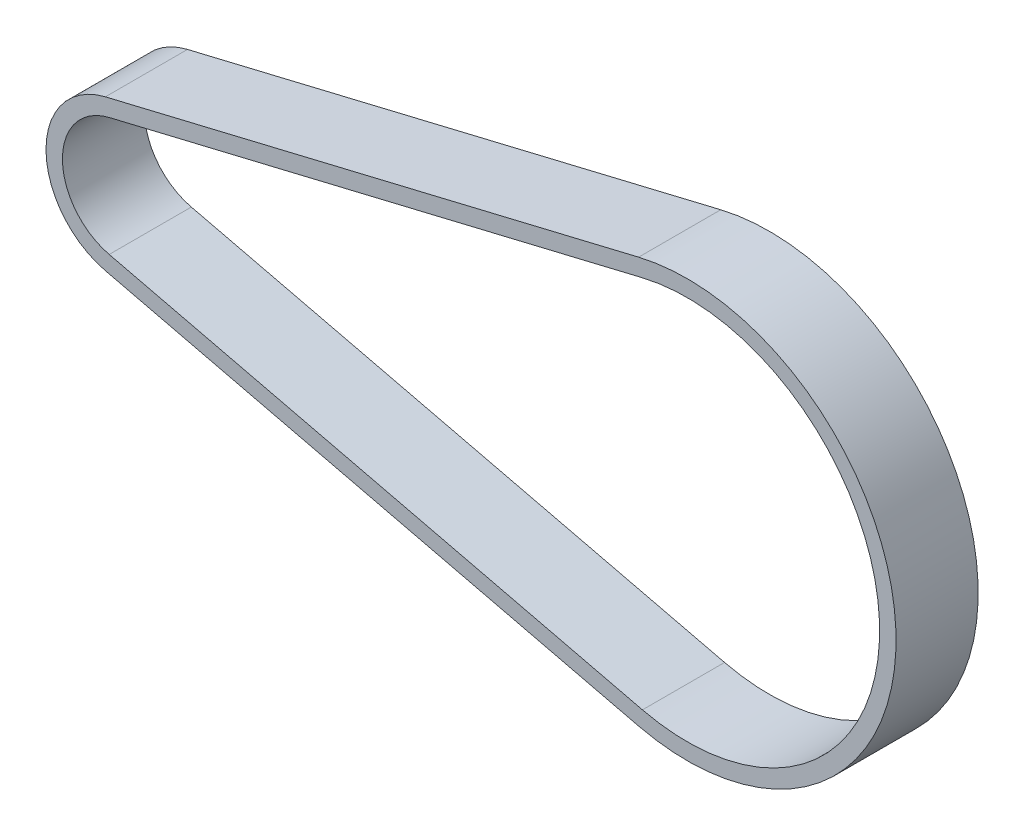
from build123d import *

# Parameters (mm, degrees)
BOSS_EXTRUDE1_DEPTH = 15


with BuildPart() as part:
    # Sketch1 → Boss-Extrude1 (new body)
    with BuildSketch(Plane.XY):
        with BuildLine():
            Line((94.112812579, 37.090996678), (-3.294954412, 13.751610869))
            ThreePointArc((-3.294954412, 13.751610869), (-14.140846016, 0), (-3.294954412, -13.751610869))
            Line((-3.294954412, -13.751610869), (94.112812579, -37.090996678))
            ThreePointArc((94.112812579, -37.090996678), (141.140846016, 0), (94.112812579, 37.090996678))
        make_face()
        with BuildLine():
            Line((94.811841705, 34.173573452), (-2.595925285, 10.834187643))
            ThreePointArc((-2.595925285, 10.834187643), (-11.140846016, 0), (-2.595925285, -10.834187643))
            Line((-2.595925285, -10.834187643), (94.811841705, -34.173573452))
            ThreePointArc((94.811841705, -34.173573452), (138.140846016, 0), (94.811841705, 34.173573452))
        make_face(mode=Mode.SUBTRACT)
    extrude(amount=BOSS_EXTRUDE1_DEPTH)


solid = part.part
